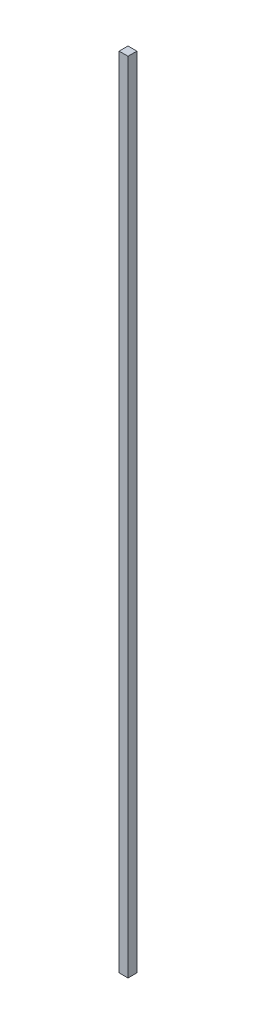
from build123d import *

# Parameters (mm, degrees)
SKETCH1_W           = 25.4
SKETCH1_H           = 25.4
BOSS_EXTRUDE1_DEPTH = 2286


with BuildPart() as part:
    # Sketch1 → Boss-Extrude1 (new body)
    with BuildSketch(Plane(origin=(0, 0, 0), x_dir=(1, 0, 0), z_dir=(0, 1, 0))):
        with Locations((12.7, 12.7)):
            Rectangle(SKETCH1_W, SKETCH1_H)
    extrude(amount=BOSS_EXTRUDE1_DEPTH)


solid = part.part
